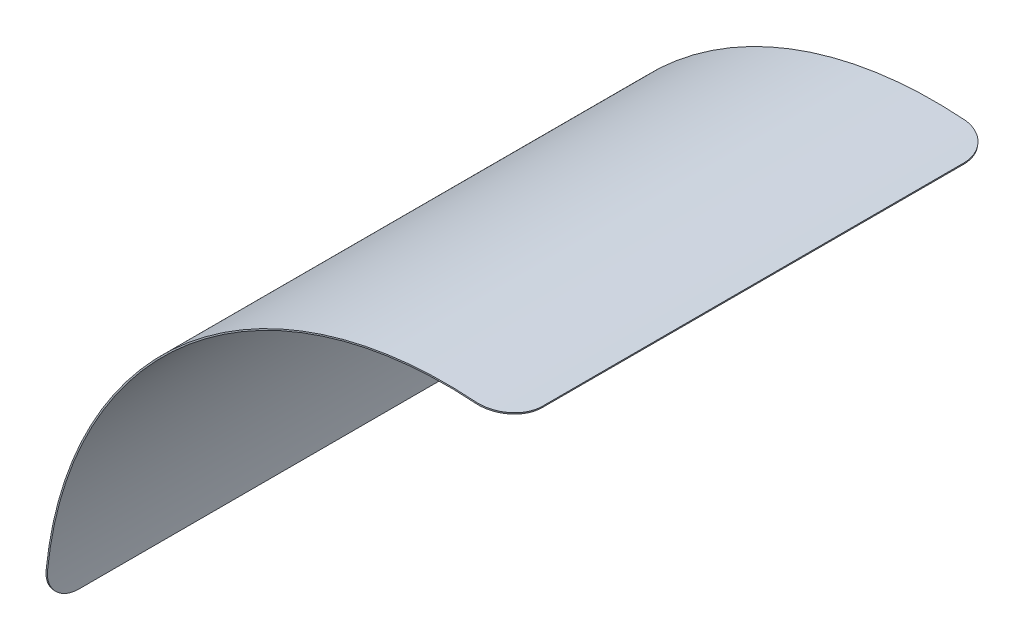
from build123d import *

# Parameters (mm, degrees)
BOSS_EXTRUDE1_DEPTH = 1450
FILLET1_START       = -1
FILLET1_DEPTH       = 10
FILLET1_START_2     = 1370
FILLET1_2_DEPTH     = 11


with BuildPart() as part:
    # Sketch1 → Boss-Extrude1 (new body)
    with BuildSketch(Plane.XY):
        with BuildLine():
            Line((1379.522237955, 1177.41513497), (1378.893822938, 1173.464806558))
            ThreePointArc((1378.893822938, 1173.464806558), (428.446906418, 910.229328203), (4.167191444, 19.932197101))
            Line((4.167191444, 19.932197101), (0.167754274, 19.99929645))
            ThreePointArc((0.167754274, 19.99929645), (425.87575598, 913.293505975), (1379.522237955, 1177.41513497))
        make_face()
    extrude(amount=BOSS_EXTRUDE1_DEPTH)

    # Fillet1: read off the stored shape, not the designer's step
    # Fillet1 outline → Fillet1 (cut)
    with BuildSketch(Plane(origin=(0, 0, 0), x_dir=(0.016774837236560897, 0.9998592925185458, 0), z_dir=(0.9998592925185458, -0.016774837236560897, 0)).offset(FILLET1_START)):
        with BuildLine():
            ThreePointArc((119.99929645, 0), (49.288618332, 29.289321882), (19.99929645, 100))
            Line((19.99929645, 100), (19.99929645, 0))
            Line((19.99929645, 0), (119.99929645, 0))
        make_face()
        with BuildLine():
            ThreePointArc((19.99929645, 1350), (49.288618331, 1420.710678119), (119.99929645, 1450))
            Line((119.99929645, 1450), (19.99929645, 1450))
            Line((19.99929645, 1450), (19.99929645, 1350))
        make_face()
    extrude(amount=FILLET1_DEPTH, mode=Mode.SUBTRACT)

    # Fillet1 2 outline → Fillet1 2 (cut)
    with BuildSketch(Plane(origin=(0, 0, 0), x_dir=(0.9875821031103624, -0.15710375430305096, 0), z_dir=(0.15710375430305093, 0.9875821031103625, 0)).offset(FILLET1_START_2)):
        with BuildLine():
            Line((1177.41513497, 0), (1077.41513497, 0))
            ThreePointArc((1077.41513497, 0), (1148.125813089, -29.289321881), (1177.41513497, -100))
            Line((1177.41513497, -100), (1177.41513497, 0))
        make_face()
        with BuildLine():
            Line((1177.41513497, -1450), (1177.41513497, -1350))
            ThreePointArc((1177.41513497, -1350), (1148.125813089, -1420.710678119), (1077.41513497, -1450))
            Line((1077.41513497, -1450), (1177.41513497, -1450))
        make_face()
    extrude(amount=FILLET1_2_DEPTH, mode=Mode.SUBTRACT)


solid = part.part
